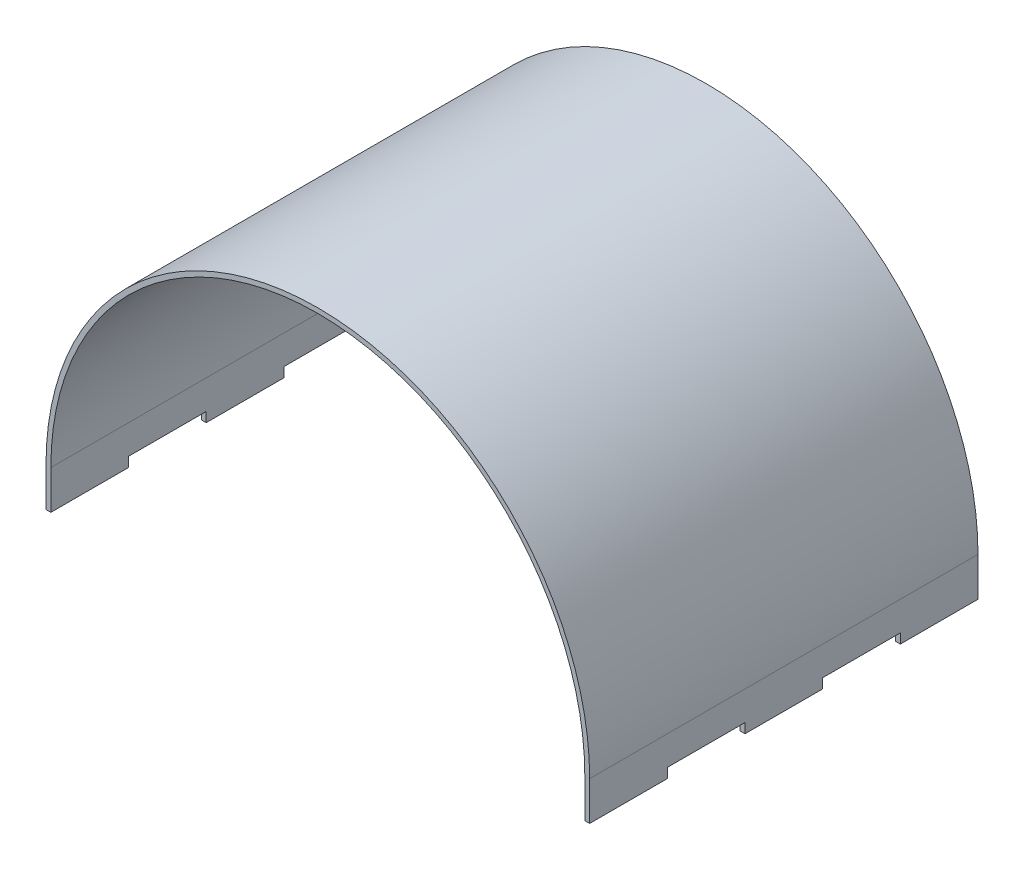
from build123d import *

# Parameters (mm, degrees)
BOSS_EXTRUDE1_DEPTH = 254
SKETCH2_W           = 50.8
SKETCH2_H           = 6.35
CUT_EXTRUDE1_DEPTH  = 482.93111541


with BuildPart() as part:
    # Sketch1 → Boss-Extrude1 (new body)
    with BuildSketch(Plane.XY):
        with BuildLine():
            Line((0, 0), (3.175, 0))
            Line((3.175, 0), (3.175, 25.4))
            ThreePointArc((3.175, 25.4), (177.8, 200.025), (352.425, 25.4))
            Line((352.425, 25.4), (352.425, 0))
            Line((352.425, 0), (355.6, 0))
            Line((355.6, 0), (355.6, 25.4))
            ThreePointArc((355.6, 25.4), (177.8, 203.2), (0, 25.4))
            Line((0, 25.4), (0, 0))
        make_face()
    extrude(amount=BOSS_EXTRUDE1_DEPTH)

    # Sketch2 → Cut-Extrude1 (cut, through all)
    with BuildSketch(Plane(origin=(355.6, 0, 0), x_dir=(0, 0, -1), z_dir=(1, 0, 0))):
        with Locations((-177.8, 3.175)):
            Rectangle(SKETCH2_W, SKETCH2_H)
        with Locations((-76.2, 3.175)):
            Rectangle(SKETCH2_W, SKETCH2_H)
    extrude(amount=-CUT_EXTRUDE1_DEPTH, mode=Mode.SUBTRACT)


solid = part.part
